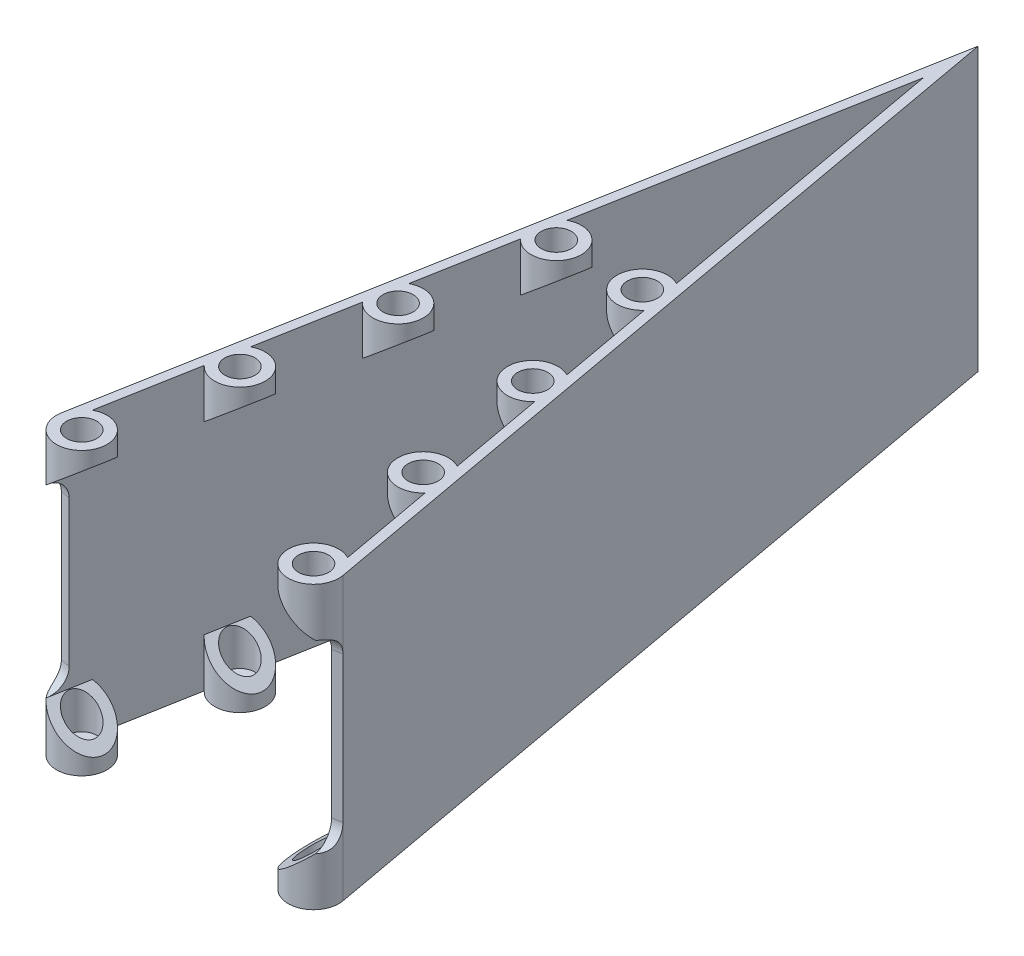
from build123d import *

# Parameters (mm, degrees)
BOSS_EXTRUDE1_DEPTH            = 29
SKETCH2_R                      = 2.6
SKETCH2_R_2                    = 1.55
BOSS_EXTRUDE3_DEPTH            = 5
CUT_EXTRUDE1_REACH             = 90.599
CUT_EXTRUDE1_DIRECTION_2_DEPTH = 89.598840586
CUT_EXTRUDE2_REACH             = 90.599
CUT_EXTRUDE2_DIRECTION_2_DEPTH = 89.598840586
FILLET1_R                      = 2
SKETCH6_R                      = 2.6
BOSS_EXTRUDE4_DEPTH            = 1


with BuildPart() as part:
    # Sketch1 → Boss-Extrude1 (new body)
    with BuildSketch(Plane(origin=(0, 0, 0), x_dir=(1, 0, 0), z_dir=(0, 1, 0))):
        Polygon((-13.5, 0), (0, 74.39897269), (13.5, 0), (14.483932895, 0.178538676), (0, 80), (-14.483932895, 0.178538676), align=None)
    extrude(amount=BOSS_EXTRUDE1_DEPTH)

    # Sketch2 → Boss-Extrude3 (add)
    # profile 1 of 8: a face of its own
    with BuildSketch(Plane(origin=(0, 0, 0), x_dir=(1, 0, 0), z_dir=(0, 1, 0))):
        with Locations((11.925707369, -0.285661882)):
            Circle(SKETCH2_R)
        with Locations(Location((11.925707369, -0.285661882, 0), (0, 0, 270))):
            Circle(SKETCH2_R_2, mode=Mode.SUBTRACT)
    # profile 2 of 8: a face of its own
    with BuildSketch(Plane(origin=(0, 0, 0), x_dir=(1, 0, 0), z_dir=(0, 1, 0))):
        with Locations((9.426165905, 13.489398644)):
            Circle(SKETCH2_R)
        with Locations(Location((9.426165905, 13.489398644, 0), (0, 0, 270))):
            Circle(SKETCH2_R_2, mode=Mode.SUBTRACT)
    # profile 3 of 8: a face of its own
    with BuildSketch(Plane(origin=(0, 0, 0), x_dir=(1, 0, 0), z_dir=(0, 1, 0))):
        with Locations((6.926624441, 27.264459169)):
            Circle(SKETCH2_R)
        with Locations(Location((6.926624441, 27.264459169, 0), (0, 0, 270))):
            Circle(SKETCH2_R_2, mode=Mode.SUBTRACT)
    # profile 4 of 8: a face of its own
    with BuildSketch(Plane(origin=(0, 0, 0), x_dir=(1, 0, 0), z_dir=(0, 1, 0))):
        with Locations((4.427082978, 41.039519694)):
            Circle(SKETCH2_R)
        with Locations(Location((4.427082978, 41.039519694, 0), (0, 0, 270))):
            Circle(SKETCH2_R_2, mode=Mode.SUBTRACT)
    # profile 5 of 8: a face of its own
    with BuildSketch(Plane(origin=(0, 0, 0), x_dir=(1, 0, 0), z_dir=(0, 1, 0))):
        with Locations((-11.925707369, -0.285661882)):
            Circle(SKETCH2_R)
        with Locations(Location((-11.925707369, -0.285661882, 0), (0, 0, 90))):
            Circle(SKETCH2_R_2, mode=Mode.SUBTRACT)
    # profile 6 of 8: a face of its own
    with BuildSketch(Plane(origin=(0, 0, 0), x_dir=(1, 0, 0), z_dir=(0, 1, 0))):
        with Locations((-9.426165905, 13.489398644)):
            Circle(SKETCH2_R)
        with Locations(Location((-9.426165905, 13.489398644, 0), (0, 0, 90))):
            Circle(SKETCH2_R_2, mode=Mode.SUBTRACT)
    # profile 7 of 8: a face of its own
    with BuildSketch(Plane(origin=(0, 0, 0), x_dir=(1, 0, 0), z_dir=(0, 1, 0))):
        with Locations((-6.926624441, 27.264459169)):
            Circle(SKETCH2_R)
        with Locations(Location((-6.926624441, 27.264459169, 0), (0, 0, 90))):
            Circle(SKETCH2_R_2, mode=Mode.SUBTRACT)
    # profile 8 of 8: a face of its own
    with BuildSketch(Plane(origin=(0, 0, 0), x_dir=(1, 0, 0), z_dir=(0, 1, 0))):
        with Locations((-4.427082978, 41.039519694)):
            Circle(SKETCH2_R)
        with Locations(Location((-4.427082978, 41.039519694, 0), (0, 0, 90))):
            Circle(SKETCH2_R_2, mode=Mode.SUBTRACT)
    boss_extrude3 = extrude(amount=BOSS_EXTRUDE3_DEPTH)

    # Cut-Extrude1: up to this face of the body (flat: up to its plane)
    cut_extrude1_end = Plane(part.part.faces().sort_by_distance((-6.66752213, 14.905805763, -37.654024776))[0])
    # Sketch4 → Cut-Extrude1 (cut, up to the picked face)
    with BuildSketch(Plane(origin=(0.430326794, 0, 2.371546029), x_dir=(0.9839328946538309, 0, -0.17853867597283662), z_dir=(0.17853867597283662, 0, 0.9839328946538309)), mode=Mode.PRIVATE) as cut_extrude1_sk1:
        Polygon((13.283094078, 5), (9.083094078, 5), (9.083094078, 1.475781549), align=None)
    cut_extrude1_tool1 = split(extrude(cut_extrude1_sk1.sketch, amount=-CUT_EXTRUDE1_REACH, mode=Mode.PRIVATE), bisect_by=cut_extrude1_end, keep=Keep.BOTH, mode=Mode.PRIVATE)
    cut_extrude1 = cut_extrude1_tool1.solids().sort_by(Axis((10.744988, 3.825261, 0.499908), (-0.17853867597283662, 0, -0.9839328946538309)))[0]
    add(cut_extrude1, mode=Mode.SUBTRACT)

    # Sketch4 → Cut-Extrude1 direction 2 (cut)
    with BuildSketch(Plane(origin=(0.430326794, 0, 2.371546029), x_dir=(0.9839328946538309, 0, -0.17853867597283662), z_dir=(0.17853867597283662, 0, 0.9839328946538309))):
        Polygon((13.283094078, 5), (9.083094078, 5), (9.083094078, 1.475781549), align=None)
    cut_extrude1_direction_2 = extrude(amount=CUT_EXTRUDE1_DIRECTION_2_DEPTH, mode=Mode.SUBTRACT)

    # Cut-Extrude2: up to this face of the body (flat: up to its plane)
    cut_extrude2_end = Plane(part.part.faces().sort_by_distance((6.66752213, 14.905805763, -37.654024776))[0])
    # Sketch5 → Cut-Extrude2 (cut, up to the picked face)
    with BuildSketch(Plane(origin=(-0.430326794, 0, 2.371546029), x_dir=(0.9839328946538308, 0, 0.17853867597283732), z_dir=(-0.17853867597283732, 0, 0.9839328946538308)), mode=Mode.PRIVATE) as cut_extrude2_sk1:
        Polygon((-9.083094078, 5), (-9.083094078, 1.475781549), (-13.283094078, 5), align=None)
    cut_extrude2_tool1 = split(extrude(cut_extrude2_sk1.sketch, amount=-CUT_EXTRUDE2_REACH, mode=Mode.PRIVATE), bisect_by=cut_extrude2_end, keep=Keep.BOTH, mode=Mode.PRIVATE)
    cut_extrude2 = cut_extrude2_tool1.solids().sort_by(Axis((-10.744988, 3.825261, 0.499908), (0.17853867597283732, 0, -0.9839328946538308)))[0]
    add(cut_extrude2, mode=Mode.SUBTRACT)

    # Sketch5 → Cut-Extrude2 direction 2 (cut)
    with BuildSketch(Plane(origin=(-0.430326794, 0, 2.371546029), x_dir=(0.9839328946538308, 0, 0.17853867597283732), z_dir=(-0.17853867597283732, 0, 0.9839328946538308))):
        Polygon((-9.083094078, 5), (-9.083094078, 1.475781549), (-13.283094078, 5), align=None)
    cut_extrude2_direction_2 = extrude(amount=CUT_EXTRUDE2_DIRECTION_2_DEPTH, mode=Mode.SUBTRACT)

    # Mirror2: Boss-Extrude3, Cut-Extrude1, Cut-Extrude1 direction 2, Cut-Extrude2, Cut-Extrude2 direction 2 across plane
    add(boss_extrude3.mirror(Plane.ZX.offset(14.5)))
    add(cut_extrude1.mirror(Plane.ZX.offset(14.5)), mode=Mode.SUBTRACT)
    add(cut_extrude1_direction_2.mirror(Plane.ZX.offset(14.5)), mode=Mode.SUBTRACT)
    add(cut_extrude2.mirror(Plane.ZX.offset(14.5)), mode=Mode.SUBTRACT)
    add(cut_extrude2_direction_2.mirror(Plane.ZX.offset(14.5)), mode=Mode.SUBTRACT)

    # Fillet1
    # the kernel refuses this fillet: 2 mm, written as the material it adds along each edge
    with BuildSketch(Plane(origin=(13.5, 5, 0), x_dir=(0, 1, 0), z_dir=(0.9839328946538308, 0, -0.17853867597283668))) as fillet1_piece_1_section:
        with BuildLine():
            CenterArc((FILLET1_R, FILLET1_R), FILLET1_R, 180, 90)
            Line((0, FILLET1_R), (0, 0))
            Line((0, 0), (FILLET1_R, 0))
        make_face()
    fillet1_piece_1 = extrude(amount=6, mode=Mode.PRIVATE)
    fillet1_piece_1 = fillet1_piece_1 & Plane(origin=(11.925707369, 5.699977743, 0.285661882), x_dir=(1, 0, 0), z_dir=(0, -1, 0)) * Cylinder(2.6, 20, mode=Mode.PRIVATE)
    add(fillet1_piece_1)
    with BuildSketch(Plane(origin=(13.5, 24, 0), x_dir=(0, -1, 0), z_dir=(0.9839328946538308, 0, -0.17853867597283668))) as fillet1_piece_2_section:
        with BuildLine():
            CenterArc((FILLET1_R, -FILLET1_R), FILLET1_R, 90, 90)
            Line((0, -FILLET1_R), (0, 0))
            Line((0, 0), (FILLET1_R, 0))
        make_face()
    fillet1_piece_2 = extrude(amount=6, mode=Mode.PRIVATE)
    fillet1_piece_2 = fillet1_piece_2 & Plane(origin=(11.925707369, 23.300022258, 0.285661882), x_dir=(1, 0, 0), z_dir=(0, 1, 0)) * Cylinder(2.6, 20, mode=Mode.PRIVATE)
    add(fillet1_piece_2)
    with BuildSketch(Plane(origin=(-19.403597368, 24, -1.071232056), x_dir=(0, -1, 0), z_dir=(0.9839328946538307, 0, 0.17853867597283735))) as fillet1_piece_3_section:
        with BuildLine():
            CenterArc((FILLET1_R, -FILLET1_R), FILLET1_R, 90, 90)
            Line((0, -FILLET1_R), (0, 0))
            Line((0, 0), (FILLET1_R, 0))
        make_face()
    fillet1_piece_3 = extrude(amount=6, mode=Mode.PRIVATE)
    fillet1_piece_3 = fillet1_piece_3 & Plane(origin=(-11.925707369, 23.777637105, 0.285661882), x_dir=(1, 0, 0), z_dir=(0, 1, 0)) * Cylinder(2.6, 21, mode=Mode.PRIVATE)
    add(fillet1_piece_3)
    with BuildSketch(Plane(origin=(-19.403597368, 5, -1.071232056), x_dir=(-0.17853867597283735, 0, 0.9839328946538307), z_dir=(0.9839328946538307, 0, 0.17853867597283735))) as fillet1_piece_4_section:
        with BuildLine():
            CenterArc((FILLET1_R, -FILLET1_R), FILLET1_R, 90, 90)
            Line((0, -FILLET1_R), (0, 0))
            Line((0, 0), (FILLET1_R, 0))
        make_face()
    fillet1_piece_4 = extrude(amount=6, mode=Mode.PRIVATE)
    fillet1_piece_4 = fillet1_piece_4 & Plane(origin=(-11.925707369, 5.222362792, 0.285661882), x_dir=(1, 0, 0), z_dir=(0, -1, 0)) * Cylinder(2.6, 21, mode=Mode.PRIVATE)
    add(fillet1_piece_4)

    # Sketch6 → Boss-Extrude4 (add)
    with BuildSketch(Plane.XZ):
        with Locations((4.427082978, -41.039519694)):
            Circle(SKETCH6_R)
        with Locations((-4.427082978, -41.039519694)):
            Circle(SKETCH6_R)
        with Locations((-6.926624441, -27.264459169)):
            Circle(SKETCH6_R)
        with Locations((11.925707369, 0.285661882)):
            Circle(SKETCH6_R)
        with Locations((6.926624441, -27.264459169)):
            Circle(SKETCH6_R)
        with Locations((9.426165905, -13.489398644)):
            Circle(SKETCH6_R)
        with Locations((-9.426165905, -13.489398644)):
            Circle(SKETCH6_R)
        with Locations((-11.925707369, 0.285661882)):
            Circle(SKETCH6_R)
    extrude(amount=-BOSS_EXTRUDE4_DEPTH)


solid = part.part
